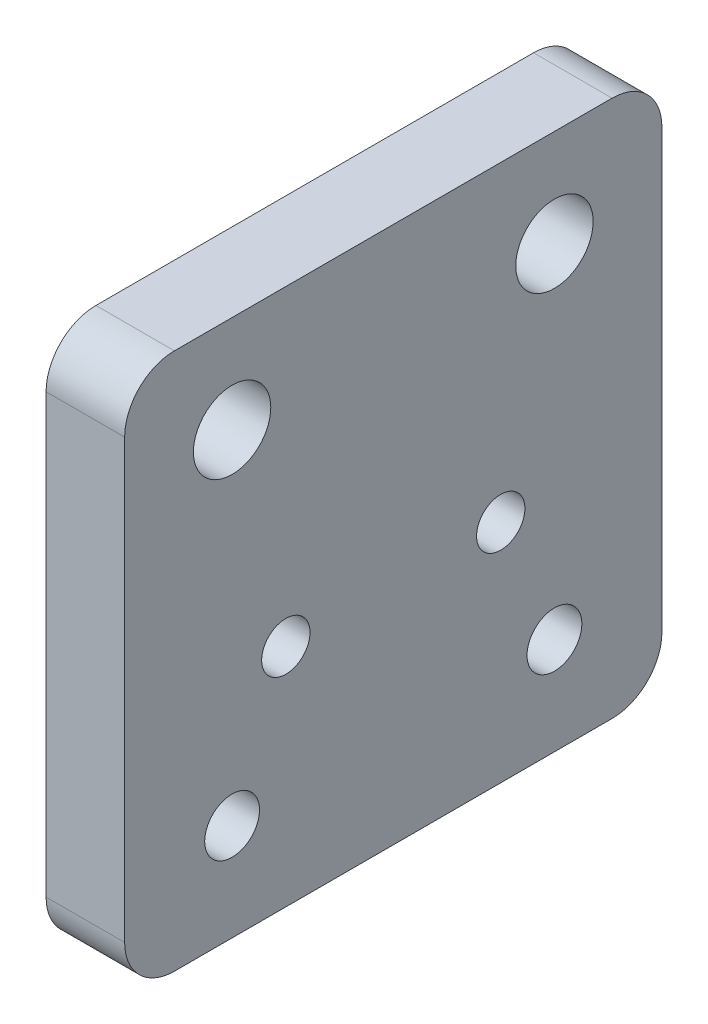
from build123d import *

# Parameters (mm, degrees)
SKETCH2_W            = 50
SKETCH2_H            = 50
BOSS_EXTRUDE1_DEPTH  = 7.31
SKETCH6_R            = 3.6
SKETCH6_R_2          = 2.55
CUT_EXTRUDE2_DEPTH   = 37.103131443
SKETCH7_R            = 5.05
SKETCH7_R_2          = 6
CUT_EXTRUDE3_DEPTH   = 2
M4_CLEARANCE_HOLE1_D = 4.5
FILLET1_R            = 4.635


with BuildPart() as part:
    # Sketch2 → Boss-Extrude1 (new body)
    with BuildSketch(Plane(origin=(0, 0, 0), x_dir=(0, 0, -1), z_dir=(1, 0, 0))):
        Rectangle(SKETCH2_W, SKETCH2_H)
    extrude(amount=BOSS_EXTRUDE1_DEPTH)

    # Sketch6 → Cut-Extrude2 (cut, through all)
    with BuildSketch(Plane(origin=(0, 0, 0), x_dir=(0, 0, -1), z_dir=(1, 0, 0))):
        with Locations((-15, 15.95)):
            Circle(SKETCH6_R)
        with Locations((15, 15.95)):
            Circle(SKETCH6_R)
        with Locations((-15, -15.95)):
            Circle(SKETCH6_R_2)
        with Locations((15, -15.95)):
            Circle(SKETCH6_R_2)
    extrude(amount=CUT_EXTRUDE2_DEPTH, mode=Mode.SUBTRACT)

    # Sketch7 → Cut-Extrude3 (cut)
    with BuildSketch(Plane.ZY):
        with Locations((-15, -15.95)):
            Circle(SKETCH7_R)
        with Locations((15, -15.95)):
            Circle(SKETCH7_R)
        with Locations((-15, 15.95)):
            Circle(SKETCH7_R_2)
        with Locations((15, 15.95)):
            Circle(SKETCH7_R_2)
    extrude(amount=-CUT_EXTRUDE3_DEPTH, mode=Mode.SUBTRACT)

    # M4 Clearance Hole1 (through all)
    with Locations(Plane(origin=(7.31, 0, 0), x_dir=(0, 0, -1), z_dir=(1, 0, 0))):
        with Locations((-10, -4), (10, -4)):
            Hole(M4_CLEARANCE_HOLE1_D / 2)

    # Fillet1
    fillet1_edges = [part.edges().sort_by_distance(p)[0] for p in [
        (3.655, -25, -25),
        (3.655, -25, 25),
        (3.655, 25, -25),
        (3.655, 25, 25),
    ]]
    fillet(fillet1_edges, radius=FILLET1_R)


solid = part.part
